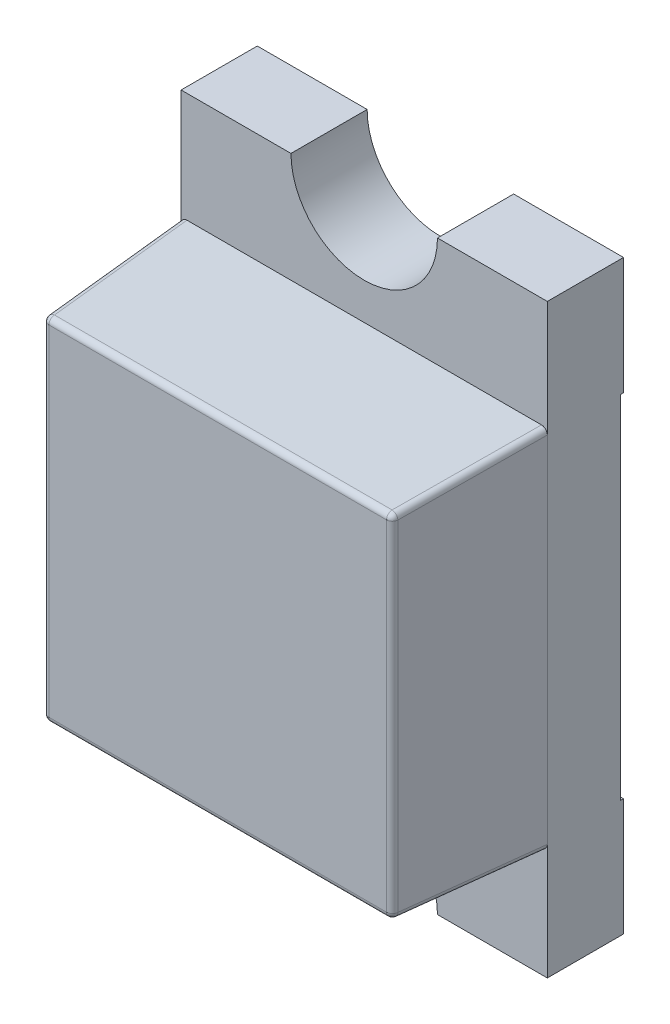
from build123d import *

# Parameters (mm, degrees)
EXTRUDE_1_DEPTH     = 0.75
CUT_EXTRUDE_1_REACH = 3.768
SKETCH_2_W          = 0.5
SKETCH_2_H          = 0.375
EXTRUDE_START       = 0.01
EXTRUDE_2_DEPTH     = 0.01
WRAP_1_DEPTH        = 0.01
CUT_EXTRUDE_2_REACH = 3.896
CHAMFER_1_SIZE      = 0.5
CHAMFER_1_SIZE_2    = 0.02620389
CHAMFER_2_SIZE      = 0.02620389
CHAMFER_2_SIZE_2    = 0.5
FILLET_1_R          = 0.02


with BuildPart() as part:
    # 草图1 → 凸台-拉伸1 (new body)
    with BuildSketch(Plane.XY):
        with BuildLine():
            Line((-0.625, 1), (-0.25, 1))
            ThreePointArc((-0.25, 1), (0, 0.75), (0.25, 1))
            Line((0.25, 1), (0.625, 1))
            Line((0.625, 1), (0.625, -1))
            Line((0.625, -1), (0.25, -1))
            ThreePointArc((0.25, -1), (0, -0.75), (-0.25, -1))
            Line((-0.25, -1), (-0.625, -1))
            Line((-0.625, -1), (-0.625, 1))
        make_face()
    extrude(amount=EXTRUDE_1_DEPTH)

    # 草图2 → 切除-拉伸1 (cut, up to next)
    with BuildSketch(Plane(origin=(0.625, 0, 0), x_dir=(0, 0, -1), z_dir=(1, 0, 0)), mode=Mode.PRIVATE) as cut_extrude_1_sk1:
        with Locations((-0.5, 0.8125)):
            Rectangle(SKETCH_2_W, SKETCH_2_H)
    cut_extrude_1_tool1 = extrude(cut_extrude_1_sk1.sketch, amount=-CUT_EXTRUDE_1_REACH, mode=Mode.PRIVATE) & part.part
    # 草图2 → 切除-拉伸1 (cut, up to next)
    with BuildSketch(Plane(origin=(0.625, 0, 0), x_dir=(0, 0, -1), z_dir=(1, 0, 0)), mode=Mode.PRIVATE) as cut_extrude_1_sk2:
        with Locations((-0.5, -0.8125)):
            Rectangle(SKETCH_2_W, SKETCH_2_H)
    cut_extrude_1_tool2 = extrude(cut_extrude_1_sk2.sketch, amount=-CUT_EXTRUDE_1_REACH, mode=Mode.PRIVATE) & part.part
    add(cut_extrude_1_tool1.solids().sort_by_distance((0.625, 0.8125, 0.5))[0], mode=Mode.SUBTRACT)
    add(cut_extrude_1_tool2.solids().sort_by_distance((0.625, -0.8125, 0.5))[0], mode=Mode.SUBTRACT)

    # 草图3 → 凸台-拉伸2 (add)
    with BuildSketch(Plane(origin=(0, 0, 0), x_dir=(-1, 0, 0), z_dir=(0, 0, -1)).offset(EXTRUDE_START)):
        with BuildLine():
            Line((-0.625, 1), (-0.625, 0.6))
            Line((-0.625, 0.6), (0.625, 0.6))
            Line((0.625, 0.6), (0.625, 1))
            Line((0.625, 1), (0.25, 1))
            ThreePointArc((0.25, 1), (0, 0.75), (-0.25, 1))
            Line((-0.25, 1), (-0.625, 1))
        make_face()
        with BuildLine():
            Line((0.625, -0.6), (-0.625, -0.6))
            Line((-0.625, -0.6), (-0.625, -1))
            Line((-0.625, -1), (-0.25, -1))
            ThreePointArc((-0.25, -1), (0, -0.75), (0.25, -1))
            Line((0.25, -1), (0.625, -1))
            Line((0.625, -1), (0.625, -0.6))
        make_face()
    extrude(amount=-EXTRUDE_2_DEPTH)

    # 包覆1: read off the stored shape, not the designer's step
    # 包覆1 outline → 包覆1 (add)
    with BuildSketch(Plane(origin=(0, 0, 0), x_dir=(-1, 0, 0), z_dir=(0, 0, -1))):
        Polygon((0.104166667, 0.013888889), (0.104166667, 0.458333333), (0.479166667, 0.458333333), (0.479166667, 0.513888889), (-0.486111111, 0.513888889), (-0.486111111, 0.458333333), (-0.111111111, 0.458333333), (-0.111111111, 0.013888889), align=None)
    extrude(amount=WRAP_1_DEPTH)

    # 草图7 → 切除-拉伸2 (cut, up to next)
    with BuildSketch(Plane(origin=(0, 0.625, 0), x_dir=(1, 0, 0), z_dir=(0, 1, 0)), mode=Mode.PRIVATE) as cut_extrude_2_sk1:
        Polygon((-0.625, -0.25), (-0.595016124, -0.75), (-0.625, -0.75), align=None)
    cut_extrude_2_tool1 = extrude(cut_extrude_2_sk1.sketch, amount=-CUT_EXTRUDE_2_REACH, mode=Mode.PRIVATE) & part.part
    # 草图7 → 切除-拉伸2 (cut, up to next)
    with BuildSketch(Plane(origin=(0, 0.625, 0), x_dir=(1, 0, 0), z_dir=(0, 1, 0)), mode=Mode.PRIVATE) as cut_extrude_2_sk2:
        Polygon((0.595016124, -0.75), (0.625, -0.75), (0.625, -0.25), align=None)
    cut_extrude_2_tool2 = extrude(cut_extrude_2_sk2.sketch, amount=-CUT_EXTRUDE_2_REACH, mode=Mode.PRIVATE) & part.part
    add(cut_extrude_2_tool1.solids().sort_by_distance((-0.615005, 0.625, 0.583333))[0], mode=Mode.SUBTRACT)
    add(cut_extrude_2_tool2.solids().sort_by_distance((0.615005, 0.625, 0.583333))[0], mode=Mode.SUBTRACT)

    # 倒角1
    # the kernel refuses this chamfer: 0.5, 0.02620389 mm, written as the material it takes off along each edge
    with BuildSketch(Plane(origin=(1.894950234, 0.625, 0.75), x_dir=(0, 0, -1), z_dir=(-1, 0, 0))) as chamfer_1_piece_1_section:
        Polygon((CHAMFER_1_SIZE, 0), (0, CHAMFER_1_SIZE_2 * 0.99999998632), (0, 0), align=None)
    chamfer_1_piece_1 = extrude(amount=3.789900469, mode=Mode.PRIVATE)
    chamfer_1_piece_1 = split(chamfer_1_piece_1, bisect_by=Plane(origin=(1.894950234, 0.625, 0.25), z_dir=(0, 0, 1)), keep=Keep.TOP, mode=Mode.PRIVATE)
    add(chamfer_1_piece_1, mode=Mode.SUBTRACT)

    # 倒角2
    # the kernel refuses this chamfer: 0.5, 0.02620389 mm, written as the material it takes off along each edge
    with BuildSketch(Plane(origin=(1.894950234, -0.625, 0.75), x_dir=(0, 1, 0), z_dir=(-1, 0, 0))) as chamfer_2_piece_1_section:
        Polygon((CHAMFER_2_SIZE * 0.99999998632, 0), (0, CHAMFER_2_SIZE_2), (0, 0), align=None)
    chamfer_2_piece_1 = extrude(amount=3.789900469, mode=Mode.PRIVATE)
    chamfer_2_piece_1 = split(chamfer_2_piece_1, bisect_by=Plane(origin=(1.894950234, -0.625, 0.25), z_dir=(0, 0, 1)), keep=Keep.TOP, mode=Mode.PRIVATE)
    add(chamfer_2_piece_1, mode=Mode.SUBTRACT)

    # 圆角1
    # the kernel refuses this fillet: 0.02 mm, written as the material it takes off along each edge
    with BuildSketch(Plane(origin=(0.57617955, 0.579816819, 0.73), x_dir=(0.04124395278448508, 0.7247571544349799, -0.6877688590318859), z_dir=(0.5553605365793874, 0.5555957455592435, 0.618779477622459))) as fillet_1_piece_1_section:
        Polygon((-0.040070478, -0.040070478), (0.040070478, -0.040070478), (0.040070478, 0.040070478), (-0.040070478, 0.040070478), align=None)
    fillet_1_piece_1 = extrude(amount=0.040070478, mode=Mode.PRIVATE)
    fillet_1_piece_1 = split(fillet_1_piece_1, bisect_by=Plane(origin=(0.57617955, 0.579816819, 0.73), z_dir=(0, 1, 0)), keep=Keep.TOP, mode=Mode.PRIVATE)
    fillet_1_piece_1 = split(fillet_1_piece_1, bisect_by=Plane(origin=(0.57617955, 0.579816819, 0.73), z_dir=(1, 0, 0)), keep=Keep.TOP, mode=Mode.PRIVATE)
    fillet_1_piece_1 = split(fillet_1_piece_1, bisect_by=Plane(origin=(0.57617955, 0.579816819, 0.73), z_dir=(-0.05977847359904646, -0.052242362176689705, 0.9968436535828312)), keep=Keep.TOP, mode=Mode.PRIVATE)
    fillet_1_piece_1 = split(fillet_1_piece_1, bisect_by=Plane(origin=(0.596143685, 0.579816819, 0.731197204), z_dir=(-0.9982067693968444, 0, -0.0598602165909465)), keep=Keep.TOP, mode=Mode.PRIVATE)
    fillet_1_piece_1 = split(fillet_1_piece_1, bisect_by=Plane(origin=(0.57617955, 0.579816819, 0.75), z_dir=(0, 0, -1)), keep=Keep.TOP, mode=Mode.PRIVATE)
    fillet_1_piece_1 = split(fillet_1_piece_1, bisect_by=Plane(origin=(0.57617955, 0.59978941, 0.731046719), z_dir=(0, -0.9986295347545728, -0.05233595624296412)), keep=Keep.TOP, mode=Mode.PRIVATE)
    fillet_1_piece_1 = fillet_1_piece_1 - Plane(origin=(0.57617955, 0.579816819, 0.73), x_dir=(-0.5553605365793874, -0.5555957455592435, -0.618779477622459), z_dir=(0.04124395278448508, 0.7247571544349799, -0.6877688590318859)) * Sphere(FILLET_1_R, mode=Mode.PRIVATE)
    add(fillet_1_piece_1, mode=Mode.SUBTRACT)
    with BuildSketch(Plane(origin=(-0.57617955, 0.579816819, 0.73), x_dir=(0.7072564722746582, 0.7069570584028463, 0), z_dir=(-0.5553605365793893, 0.5555957455592451, 0.6187794776224558))) as fillet_1_piece_2_section:
        Polygon((-0.040070478, -0.040070478), (0.040070478, -0.040070478), (0.040070478, 0.040070478), (-0.040070478, 0.040070478), align=None)
    fillet_1_piece_2 = extrude(amount=0.040070478, mode=Mode.PRIVATE)
    fillet_1_piece_2 = split(fillet_1_piece_2, bisect_by=Plane(origin=(-0.57617955, 0.579816819, 0.73), z_dir=(-1, 0, 0)), keep=Keep.TOP, mode=Mode.PRIVATE)
    fillet_1_piece_2 = split(fillet_1_piece_2, bisect_by=Plane(origin=(-0.57617955, 0.579816819, 0.73), z_dir=(0.0597784735990376, -0.05224236217668974, 0.9968436535828318)), keep=Keep.TOP, mode=Mode.PRIVATE)
    fillet_1_piece_2 = split(fillet_1_piece_2, bisect_by=Plane(origin=(-0.57617955, 0.579816819, 0.73), z_dir=(0, 1, 0)), keep=Keep.TOP, mode=Mode.PRIVATE)
    fillet_1_piece_2 = split(fillet_1_piece_2, bisect_by=Plane(origin=(-0.57617955, 0.579816819, 0.75), z_dir=(0, 0, -1)), keep=Keep.TOP, mode=Mode.PRIVATE)
    fillet_1_piece_2 = split(fillet_1_piece_2, bisect_by=Plane(origin=(-0.57617955, 0.59978941, 0.731046719), z_dir=(0, -0.9986295347545728, -0.05233595624296412)), keep=Keep.TOP, mode=Mode.PRIVATE)
    fillet_1_piece_2 = split(fillet_1_piece_2, bisect_by=Plane(origin=(-0.596143685, 0.579816819, 0.731197204), z_dir=(0.998206769396845, 0, -0.05986021659093763)), keep=Keep.TOP, mode=Mode.PRIVATE)
    fillet_1_piece_2 = fillet_1_piece_2 - Plane(origin=(-0.57617955, 0.579816819, 0.73), x_dir=(0.5553605365793893, -0.5555957455592451, -0.6187794776224558), z_dir=(0.7072564722746582, 0.7069570584028463, 0)) * Sphere(FILLET_1_R, mode=Mode.PRIVATE)
    add(fillet_1_piece_2, mode=Mode.SUBTRACT)
    with BuildSketch(Plane(origin=(0.57617955, -0.579816819, 0.73), x_dir=(-0.04124395278448508, 0.7247571544349799, 0.6877688590318859), z_dir=(0.5553605365793874, -0.5555957455592435, 0.618779477622459))) as fillet_1_piece_3_section:
        Polygon((-0.040070478, -0.040070478), (0.040070478, -0.040070478), (0.040070478, 0.040070478), (-0.040070478, 0.040070478), align=None)
    fillet_1_piece_3 = extrude(amount=0.040070478, mode=Mode.PRIVATE)
    fillet_1_piece_3 = split(fillet_1_piece_3, bisect_by=Plane(origin=(0.57617955, -0.579816819, 0.73), z_dir=(0, -1, 0)), keep=Keep.TOP, mode=Mode.PRIVATE)
    fillet_1_piece_3 = split(fillet_1_piece_3, bisect_by=Plane(origin=(0.57617955, -0.579816819, 0.73), z_dir=(1, 0, 0)), keep=Keep.TOP, mode=Mode.PRIVATE)
    fillet_1_piece_3 = split(fillet_1_piece_3, bisect_by=Plane(origin=(0.57617955, -0.579816819, 0.73), z_dir=(-0.05977847359904646, 0.052242362176689705, 0.9968436535828312)), keep=Keep.TOP, mode=Mode.PRIVATE)
    fillet_1_piece_3 = split(fillet_1_piece_3, bisect_by=Plane(origin=(0.596143685, -0.579816819, 0.731197204), z_dir=(-0.9982067693968444, 0, -0.0598602165909465)), keep=Keep.TOP, mode=Mode.PRIVATE)
    fillet_1_piece_3 = split(fillet_1_piece_3, bisect_by=Plane(origin=(0.57617955, -0.579816819, 0.75), z_dir=(0, 0, -1)), keep=Keep.TOP, mode=Mode.PRIVATE)
    fillet_1_piece_3 = split(fillet_1_piece_3, bisect_by=Plane(origin=(0.57617955, -0.59978941, 0.731046719), z_dir=(0, 0.9986295347545728, -0.05233595624296412)), keep=Keep.TOP, mode=Mode.PRIVATE)
    fillet_1_piece_3 = fillet_1_piece_3 - Plane(origin=(0.57617955, -0.579816819, 0.73), x_dir=(-0.5553605365793874, 0.5555957455592435, -0.618779477622459), z_dir=(-0.04124395278448508, 0.7247571544349799, 0.6877688590318859)) * Sphere(FILLET_1_R, mode=Mode.PRIVATE)
    add(fillet_1_piece_3, mode=Mode.SUBTRACT)
    with BuildSketch(Plane(origin=(-0.57617955, -0.579816819, 0.73), x_dir=(-0.041243952784478954, -0.72475715443498, -0.687768859031886), z_dir=(-0.5553605365793893, -0.5555957455592451, 0.6187794776224558))) as fillet_1_piece_4_section:
        Polygon((-0.040070478, -0.040070478), (0.040070478, -0.040070478), (0.040070478, 0.040070478), (-0.040070478, 0.040070478), align=None)
    fillet_1_piece_4 = extrude(amount=0.040070478, mode=Mode.PRIVATE)
    fillet_1_piece_4 = split(fillet_1_piece_4, bisect_by=Plane(origin=(-0.57617955, -0.579816819, 0.73), z_dir=(0.0597784735990376, 0.05224236217668974, 0.9968436535828318)), keep=Keep.TOP, mode=Mode.PRIVATE)
    fillet_1_piece_4 = split(fillet_1_piece_4, bisect_by=Plane(origin=(-0.57617955, -0.579816819, 0.73), z_dir=(-1, 0, 0)), keep=Keep.TOP, mode=Mode.PRIVATE)
    fillet_1_piece_4 = split(fillet_1_piece_4, bisect_by=Plane(origin=(-0.57617955, -0.579816819, 0.73), z_dir=(0, -1, 0)), keep=Keep.TOP, mode=Mode.PRIVATE)
    fillet_1_piece_4 = split(fillet_1_piece_4, bisect_by=Plane(origin=(-0.596143685, -0.579816819, 0.731197204), z_dir=(0.998206769396845, 0, -0.05986021659093763)), keep=Keep.TOP, mode=Mode.PRIVATE)
    fillet_1_piece_4 = split(fillet_1_piece_4, bisect_by=Plane(origin=(-0.57617955, -0.59978941, 0.731046719), z_dir=(0, 0.9986295347545728, -0.05233595624296412)), keep=Keep.TOP, mode=Mode.PRIVATE)
    fillet_1_piece_4 = split(fillet_1_piece_4, bisect_by=Plane(origin=(-0.57617955, -0.579816819, 0.75), z_dir=(0, 0, -1)), keep=Keep.TOP, mode=Mode.PRIVATE)
    fillet_1_piece_4 = fillet_1_piece_4 - Plane(origin=(-0.57617955, -0.579816819, 0.73), x_dir=(0.5553605365793893, 0.5555957455592451, -0.6187794776224558), z_dir=(-0.041243952784478954, -0.72475715443498, -0.687768859031886)) * Sphere(FILLET_1_R, mode=Mode.PRIVATE)
    add(fillet_1_piece_4, mode=Mode.SUBTRACT)
    with BuildSketch(Plane(origin=(0.596081336, 0.599727034, 0.732236916), x_dir=(-0.9982116679813796, 0.0031285635785502862, -0.059696549278554306), z_dir=(0.059778473599046464, 0.05224236217668971, -0.9968436535828313))) as fillet_1_piece_5_section:
        with BuildLine():
            CenterArc((FILLET_1_R * 0.996872050334, -FILLET_1_R), FILLET_1_R, 90, 89.8205011)
            Line((-FILLET_1_R * 0.00312304230512, -FILLET_1_R * 0.996867158324), (0, 0))
            Line((0, 0), (FILLET_1_R * 0.996872050334, 0))
        make_face()
    fillet_1_piece_5 = extrude(amount=0.533607444, mode=Mode.PRIVATE)
    fillet_1_piece_5 = split(fillet_1_piece_5, bisect_by=Plane(origin=(0.596081336, 0.599727034, 0.25), z_dir=(0, 0, 1)), keep=Keep.TOP, mode=Mode.PRIVATE)
    add(fillet_1_piece_5, mode=Mode.SUBTRACT)
    with BuildSketch(Plane(origin=(0.57617955, 0.59879611, 0.75), x_dir=(0, 0.05233595624296042, -0.9986295347545731), z_dir=(-1, 0, 0)), Plane(origin=(0.57617955, -0.59879611, 0.75), x_dir=(0, 1, 0), z_dir=(-1, 0, 0))) as fillet_1_piece_6:
        with BuildLine():
            CenterArc((FILLET_1_R * 0.948964566715, FILLET_1_R), FILLET_1_R, 183, 87)
            Line((-FILLET_1_R * 0.0496649680397, FILLET_1_R * 0.947664043757), (0, 0))
            Line((0, 0), (FILLET_1_R * 0.948964566715, 0))
        make_face()
    extrude(amount=1.152359099, mode=Mode.SUBTRACT)
    with BuildSketch(Plane(origin=(-0.596081336, 0.599727034, 0.732236916), x_dir=(-0.003127239115103472, -0.9986344354137802, -0.052148679574054314), z_dir=(-0.0597784735990376, 0.05224236217668974, -0.9968436535828318))) as fillet_1_piece_7_section:
        with BuildLine():
            CenterArc((FILLET_1_R * 0.996872050334, -FILLET_1_R), FILLET_1_R, 90, 89.8205011)
            Line((-FILLET_1_R * 0.00312304230511, -FILLET_1_R * 0.996867158324), (0, 0))
            Line((0, 0), (FILLET_1_R * 0.996872050334, 0))
        make_face()
    fillet_1_piece_7 = extrude(amount=0.533607444, mode=Mode.PRIVATE)
    fillet_1_piece_7 = split(fillet_1_piece_7, bisect_by=Plane(origin=(-0.596081336, 0.599727034, 0.25), z_dir=(0, 0, 1)), keep=Keep.TOP, mode=Mode.PRIVATE)
    add(fillet_1_piece_7, mode=Mode.SUBTRACT)
    with BuildSketch(Plane(origin=(0.595016124, 0.579816819, 0.75), x_dir=(0.05986021659094882, 0, -0.9982067693968444), z_dir=(0, -1, 0))) as fillet_1_piece_8:
        with BuildLine():
            CenterArc((FILLET_1_R * 0.941828699456, -FILLET_1_R), FILLET_1_R, 90, 86.568210653)
            Line((-FILLET_1_R * 0.056378069941, -FILLET_1_R * 0.940139783409), (0, 0))
            Line((0, 0), (FILLET_1_R * 0.941828699456, 0))
        make_face()
    extrude(amount=1.159633638, mode=Mode.SUBTRACT)
    with BuildSketch(Plane(origin=(-0.595016124, 0.579816819, 0.75), x_dir=(-0.05986021659093708, 0, -0.998206769396845), z_dir=(0, -1, 0))) as fillet_1_piece_9:
        with BuildLine():
            CenterArc((FILLET_1_R * 0.941828699456, FILLET_1_R), FILLET_1_R, 183.431789347, 86.568210653)
            Line((-FILLET_1_R * 0.056378069941, FILLET_1_R * 0.940139783409), (0, 0))
            Line((0, 0), (FILLET_1_R * 0.941828699456, 0))
        make_face()
    extrude(amount=1.159633638, mode=Mode.SUBTRACT)
    with BuildSketch(Plane(origin=(0.627979574, -0.627603948, 0.200313721), x_dir=(0.003127239115114234, 0.9986344354137802, -0.05214867957405363), z_dir=(-0.059778473599046464, 0.05224236217668971, 0.9968436535828313))) as fillet_1_piece_10_section:
        with BuildLine():
            CenterArc((FILLET_1_R * 0.996872050334, FILLET_1_R), FILLET_1_R, 180.1794989, 89.8205011)
            Line((-FILLET_1_R * 0.00312304230511, FILLET_1_R * 0.996867158324), (0, 0))
            Line((0, 0), (FILLET_1_R * 0.996872050334, 0))
        make_face()
    fillet_1_piece_10 = extrude(amount=0.533607444, mode=Mode.PRIVATE)
    fillet_1_piece_10 = split(fillet_1_piece_10, bisect_by=Plane(origin=(0.627979574, -0.627603948, 0.25), z_dir=(0, 0, 1)), keep=Keep.TOP, mode=Mode.PRIVATE)
    add(fillet_1_piece_10, mode=Mode.SUBTRACT)
    with BuildSketch(Plane(origin=(-0.627979574, -0.627603948, 0.200313721), x_dir=(-0.0031272391150979234, 0.9986344354137803, -0.052148679574054654), z_dir=(0.0597784735990376, 0.05224236217668974, 0.9968436535828318))) as fillet_1_piece_11_section:
        with BuildLine():
            CenterArc((FILLET_1_R * 0.996872050334, -FILLET_1_R), FILLET_1_R, 90, 89.8205011)
            Line((-FILLET_1_R * 0.0031230423051, -FILLET_1_R * 0.996867158324), (0, 0))
            Line((0, 0), (FILLET_1_R * 0.996872050334, 0))
        make_face()
    fillet_1_piece_11 = extrude(amount=0.533607444, mode=Mode.PRIVATE)
    fillet_1_piece_11 = split(fillet_1_piece_11, bisect_by=Plane(origin=(-0.627979574, -0.627603948, 0.25), z_dir=(0, 0, 1)), keep=Keep.TOP, mode=Mode.PRIVATE)
    add(fillet_1_piece_11, mode=Mode.SUBTRACT)


solid = part.part
